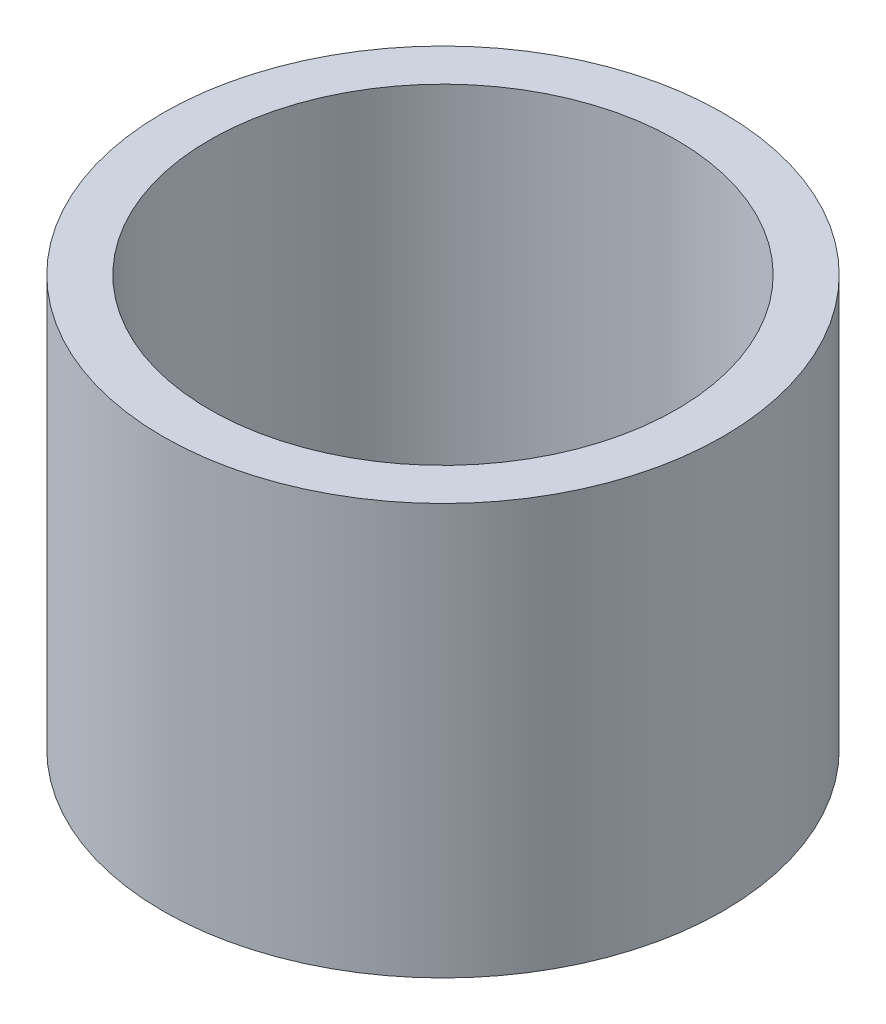
from build123d import *

# Parameters (mm, degrees)
BOSS_EXTRUDE1_DEPTH     = 7
SKETCH2_R               = 9.996
BOSS_EXTRUDE2_DEPTH     = 7
CIRPATTERN3_COUNT       = 30
SKETCH3_R               = 11.946
BOSS_EXTRUDE3_DEPTH     = 1.2
BOSS_EXTRUDE4_START     = 1.2
SKETCH4_R               = 11.946
BOSS_EXTRUDE4_DEPTH     = 1.2
SKETCH12_R              = 7.5
BOSS_EXTRUDE10_DEPTH    = 8.6
CUT_EXTRUDE1_DEPTH      = 20.333231287
CUT_EXTRUDE1_DEPTH_BACK = 20.333231287
SKETCH5_R               = 4
CHAMFER1_SIZE           = 0.3
BOSS_EXTRUDE5_DEPTH     = 8.2
BOSS_EXTRUDE6_START     = 1.2
SKETCH7_R               = 4
BOSS_EXTRUDE6_DEPTH     = 1.2
SKETCH8_R               = 7.5
BOSS_EXTRUDE7_DEPTH     = 7
CIRPATTERN4_COUNT       = 23
BOSS_EXTRUDE8_START     = 1.2
SKETCH9_R               = 8.267127382
SKETCH9_R_2             = 4
BOSS_EXTRUDE8_DEPTH     = 1.2
CHAMFER2_SIZE           = 0.3
SKETCH10_R              = 15
BOSS_EXTRUDE9_DEPTH     = 22
SKETCH11_R              = 12.5
CUT_EXTRUDE2_DEPTH      = 42


with BuildPart() as part:
    # Sketch1 → Boss-Extrude1 (new body)
    with BuildSketch(Plane(origin=(0, 0, 0), x_dir=(1, 0, 0), z_dir=(0, 1, 0))):
        with BuildLine():
            ThreePointArc((0.826498814, 9.961772719), (0.780770063, 10.016376304), (0.739043842, 10.074096254))
            ThreePointArc((0.739043842, 10.074096254), (0.635968618, 10.193168964), (0.570490053, 10.336400838))
            ThreePointArc((0.570490053, 10.336400838), (0.535253256, 10.511107627), (0.53093728, 10.689280202))
            ThreePointArc((0.53093728, 10.689280202), (0.483560109, 10.723802473), (0.426569466, 10.737530186))
            ThreePointArc((0.426569466, 10.737530186), (0, 10.746), (-0.426569466, 10.737530186))
            ThreePointArc((-0.426569466, 10.737530186), (-0.483560109, 10.723802473), (-0.53093728, 10.689280202))
            ThreePointArc((-0.53093728, 10.689280202), (-0.535253256, 10.511107627), (-0.570490053, 10.336400838))
            ThreePointArc((-0.570490053, 10.336400838), (-0.635968618, 10.193168964), (-0.739043842, 10.074096254))
            ThreePointArc((-0.739043842, 10.074096254), (-0.780770063, 10.016376304), (-0.826498814, 9.961772719))
            ThreePointArc((-0.826498814, 9.961772719), (0, 9.996), (0.826498814, 9.961772719))
        make_face()
    boss_extrude1 = extrude(amount=BOSS_EXTRUDE1_DEPTH)

    # Sketch2 → Boss-Extrude2 (add)
    with BuildSketch(Plane.XZ):
        Circle(SKETCH2_R)
        with BuildLine():
            ThreePointArc((-0.739043842, -10.074096254), (-0.635968618, -10.193168964), (-0.570490053, -10.336400838))
            ThreePointArc((-0.570490053, -10.336400838), (-0.535253256, -10.511107627), (-0.53093728, -10.689280202))
            ThreePointArc((-0.53093728, -10.689280202), (-0.483560109, -10.723802473), (-0.426569466, -10.737530186))
            ThreePointArc((-0.426569466, -10.737530186), (0, -10.746), (0.426569466, -10.737530186))
            ThreePointArc((0.426569466, -10.737530186), (0.483560109, -10.723802473), (0.53093728, -10.689280202))
            ThreePointArc((0.53093728, -10.689280202), (0.535253256, -10.511107627), (0.570490053, -10.336400838))
            ThreePointArc((0.570490053, -10.336400838), (0.635968618, -10.193168964), (0.739043842, -10.074096254))
            ThreePointArc((0.739043842, -10.074096254), (0.780770063, -10.016376304), (0.826498814, -9.961772719))
            ThreePointArc((0.826498814, -9.961772719), (0, -9.996), (-0.826498814, -9.961772719))
            ThreePointArc((-0.826498814, -9.961772719), (-0.780770063, -10.016376304), (-0.739043842, -10.074096254))
        make_face()
    extrude(amount=-BOSS_EXTRUDE2_DEPTH)

    # CirPattern3: Boss-Extrude1 ×30 about axis
    cirpattern3_axis = Axis((0, 0, 0), (0, 1, 0))
    for i in range(1, CIRPATTERN3_COUNT):
        add(boss_extrude1.rotate(cirpattern3_axis, i * 360 / CIRPATTERN3_COUNT))

    # Sketch3 → Boss-Extrude3 (add)
    with BuildSketch(Plane(origin=(0, 7, 0), x_dir=(1, 0, 0), z_dir=(0, 1, 0))):
        with Locations(Location((0, 0, 0), (0, 0, 270))):
            Circle(SKETCH3_R)
    extrude(amount=BOSS_EXTRUDE3_DEPTH)

    # Sketch4 → Boss-Extrude4 (add)
    with BuildSketch(Plane.XZ.offset(BOSS_EXTRUDE4_START)):
        with Locations(Location((0, 0, 0), (0, 0, 90))):
            Circle(SKETCH4_R)
    extrude(amount=-BOSS_EXTRUDE4_DEPTH)

    # Sketch12 → Boss-Extrude10 (add)
    with BuildSketch(Plane(origin=(0, 8.2, 0), x_dir=(1, 0, 0), z_dir=(0, 1, 0))):
        with Locations(Location((0, 0, 0), (0, 0, 90))):
            Circle(SKETCH12_R)
    extrude(amount=BOSS_EXTRUDE10_DEPTH)

    # Sketch5 → Cut-Extrude1 (cut, two sides: drawn at the far end of the back side and taken through both)
    with BuildSketch(Plane(origin=(0, 8.2, 0), x_dir=(1, 0, 0), z_dir=(0, 1, 0)).offset(-CUT_EXTRUDE1_DEPTH_BACK)):
        with Locations(Location((0, 0, 0), (0, 0, 270))):
            Circle(SKETCH5_R)
    extrude(amount=CUT_EXTRUDE1_DEPTH + CUT_EXTRUDE1_DEPTH_BACK, mode=Mode.SUBTRACT)

    # Chamfer1
    chamfer1_edges = [part.edges().sort_by_distance(p)[0] for p in [
        (0, 16.8, 7.5),
        (0, 7, -11.946),
        (0, 0, -11.946),
    ]]
    chamfer(chamfer1_edges, length=CHAMFER1_SIZE)

    # Sketch6 → Boss-Extrude5 (add)
    with BuildSketch(Plane(origin=(0, 8.2, 0), x_dir=(1, 0, 0), z_dir=(0, 1, 0))):
        with BuildLine():
            ThreePointArc((-0.860182068, 6.258289317), (-0.751107611, 6.28473631), (-0.64958429, 6.332587076))
            ThreePointArc((-0.64958429, 6.332587076), (-0.464657297, 6.504151233), (-0.363997793, 6.735451722))
            ThreePointArc((-0.363997793, 6.735451722), (-0.349530604, 6.826022046), (-0.3434225, 6.917536931))
            ThreePointArc((-0.3434225, 6.917536931), (-0.299902072, 7.020105068), (-0.197649981, 7.064362952))
            ThreePointArc((-0.197649981, 7.064362952), (0, 7.067127382), (0.197649981, 7.064362952))
            ThreePointArc((0.197649981, 7.064362952), (0.299902072, 7.020105068), (0.3434225, 6.917536931))
            ThreePointArc((0.3434225, 6.917536931), (0.349530604, 6.826022046), (0.363997793, 6.735451722))
            ThreePointArc((0.363997793, 6.735451722), (0.464657297, 6.504151233), (0.64958429, 6.332587076))
            ThreePointArc((0.64958429, 6.332587076), (0.751107611, 6.28473631), (0.860182068, 6.258289317))
            ThreePointArc((0.860182068, 6.258289317), (0, 6.317127382), (-0.860182068, 6.258289317))
        make_face()
    boss_extrude5 = extrude(amount=BOSS_EXTRUDE5_DEPTH)

    # Sketch7 → Boss-Extrude6 (add)
    with BuildSketch(Plane(origin=(0, 8.2, 0), x_dir=(1, 0, 0), z_dir=(0, 1, 0)).offset(BOSS_EXTRUDE6_START)):
        with BuildLine():
            ThreePointArc((-0.231210997, 8.263893551), (-5.763416712, -5.926923566), (8.267127382, 0))
            ThreePointArc((8.267127382, 0), (5.926923566, 5.763416712), (0.231210997, 8.263893551))
            ThreePointArc((0.231210997, 8.263893551), (0, 8.267127382), (-0.231210997, 8.263893551))
        make_face()
        Circle(SKETCH7_R, mode=Mode.SUBTRACT)
    extrude(amount=-BOSS_EXTRUDE6_DEPTH)

    # Sketch8 → Boss-Extrude7 (add)
    with BuildSketch(Plane(origin=(0, 9.4, 0), x_dir=(1, 0, 0), z_dir=(0, 1, 0))):
        with Locations(Location((0, 0, 0), (0, 0, 90))):
            Circle(SKETCH8_R)
        with BuildLine():
            ThreePointArc((0.860182068, 6.258289317), (4.761301191, 4.151639355), (6.317127382, 0))
            ThreePointArc((6.317127382, 0), (-4.151639355, -4.761301191), (-0.860182068, 6.258289317))
            ThreePointArc((-0.860182068, 6.258289317), (0, 6.317127382), (0.860182068, 6.258289317))
        make_face(mode=Mode.SUBTRACT)
    extrude(amount=BOSS_EXTRUDE7_DEPTH)

    # CirPattern4: Boss-Extrude5 ×23 about axis
    cirpattern4_axis = Axis((0, 0, 0), (0, -1, 0))
    for i in range(1, CIRPATTERN4_COUNT):
        add(boss_extrude5.rotate(cirpattern4_axis, i * 360 / CIRPATTERN4_COUNT))

    # Sketch9 → Boss-Extrude8 (add)
    with BuildSketch(Plane(origin=(0, 16.4, 0), x_dir=(1, 0, 0), z_dir=(0, 1, 0)).offset(BOSS_EXTRUDE8_START)):
        with Locations(Location((0, 0, 0), (0, 0, 270))):
            Circle(SKETCH9_R)
        with Locations(Location((0, 0, 0), (0, 0, 270))):
            Circle(SKETCH9_R_2, mode=Mode.SUBTRACT)
    extrude(amount=-BOSS_EXTRUDE8_DEPTH)

    # Chamfer2
    chamfer2_edges = [part.edges().sort_by_distance(p)[0] for p in [
        (-8.267127382, 9.4, 0),
        (0, 16.4, -8.267127382),
    ]]
    chamfer(chamfer2_edges, length=CHAMFER2_SIZE)

    # Sketch10 → Boss-Extrude9 (add)
    with BuildSketch(Plane.XZ.offset(1.2)):
        with Locations(Location((0, 0, 0), (0, 0, 270))):
            Circle(SKETCH10_R)
    extrude(amount=BOSS_EXTRUDE9_DEPTH)

    # Sketch11 → Cut-Extrude2 (cut)
    with BuildSketch(Plane.XZ.offset(23.2)):
        with Locations(Location((0, 0, 0), (0, 0, 270))):
            Circle(SKETCH11_R)
    extrude(amount=-CUT_EXTRUDE2_DEPTH, mode=Mode.SUBTRACT)


solid = part.part
